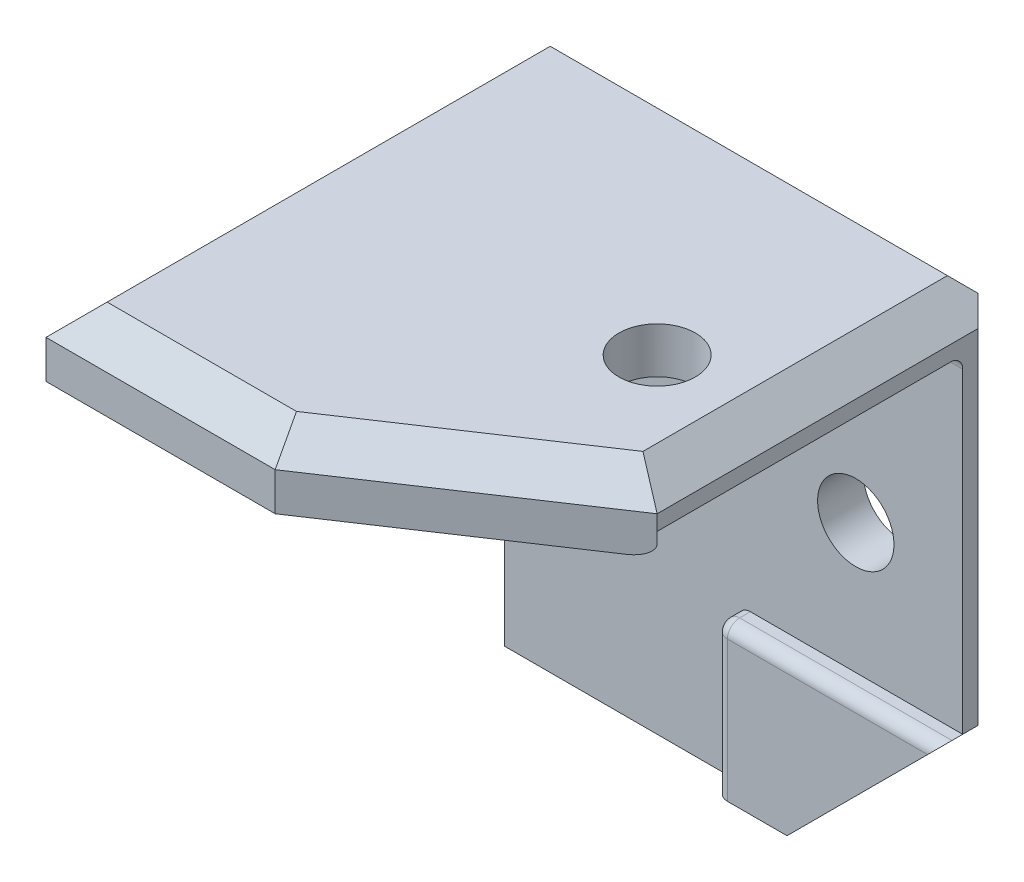
from build123d import *

# Parameters (mm, degrees)
BOSS_EXTRUDE1_DEPTH = 3
SKETCH2_W           = 15
SKETCH2_H           = 6.5
BOSS_EXTRUDE2_DEPTH = 1.5
BOSS_EXTRUDE3_DEPTH = 4.5
CUT_EXTRUDE1_DEPTH  = 1.5
FILLET1_R           = 0.8
CHAMFER1_SIZE       = 2
CHAMFER2_SIZE       = 2
FILLET2_R           = 0.8
SKETCH5_R           = 2.5
CUT_EXTRUDE2_DEPTH  = 57.384838388
SKETCH6_R           = 2.5
CUT_EXTRUDE3_DEPTH  = 57.384838388


with BuildPart() as part:
    # Sketch1 → Boss-Extrude1 (new body)
    with BuildSketch(Plane.XY):
        Polygon((0, 0), (20, 0), (30, 10), (30, 30), (0, 30), align=None)
    extrude(amount=BOSS_EXTRUDE1_DEPTH)

    # Sketch2 → Boss-Extrude2 (add)
    with BuildSketch(Plane.XY.offset(3)):
        Polygon((30, 10), (15.3, 10), (15.3, 0), (20, 0), align=None)
        with Locations((7.5, 26.75)):
            Rectangle(SKETCH2_W, SKETCH2_H)
    extrude(amount=BOSS_EXTRUDE2_DEPTH)

    # Sketch3 → Boss-Extrude3 (add)
    with BuildSketch(Plane(origin=(0, 30, 0), x_dir=(1, 0, 0), z_dir=(0, 1, 0))):
        Polygon((0, -3), (0, -33), (15, -33), (30, -23), (30, -3), (30, 0), (0, 0), align=None)
    extrude(amount=BOSS_EXTRUDE3_DEPTH)

    # Sketch4 → Cut-Extrude1 (cut)
    with BuildSketch(Plane.XZ.offset(-30)):
        Polygon((15, 23), (30, 23), (30, 3), (15, 3), (15, 4.5), align=None)
    extrude(amount=-CUT_EXTRUDE1_DEPTH, mode=Mode.SUBTRACT)

    # Fillet1
    fillet1_edges = [part.edges().sort_by_distance(p)[0] for p in [
        (15, 23.5, 3.75),
        (7.5, 23.5, 4.5),
        (15, 26.75, 4.5),
        (15.3, 5, 4.5),
        (15.3, 10, 3.75),
        (22.65, 10, 4.5),
        (15, 30, 13.75),
        (22.5, 30, 23),
        (15, 30.75, 23),
    ]]
    fillet(fillet1_edges, radius=FILLET1_R)

    # Chamfer1
    chamfer1_edges = [part.edges().sort_by_distance(p)[0] for p in [
        (15, 34.5, 0),
    ]]
    chamfer(chamfer1_edges, length=CHAMFER1_SIZE)

    # Chamfer2
    # the kernel refuses this chamfer: 2 mm, written as the material it takes off along each edge
    with BuildSketch(Plane(origin=(30, 37.643365976, 0), x_dir=(-0.9996219169112968, 0, -0.02749587661058639), z_dir=(0, -1, 0))) as chamfer2_piece_1:
        Polygon((CHAMFER2_SIZE * 0.999621916911, -CHAMFER2_SIZE * 0.0274958766106), (-CHAMFER2_SIZE * 0.0274958766106, -CHAMFER2_SIZE * 0.999621916911), (0, 0), align=None)
    extrude(amount=32.786731952, mode=Mode.SUBTRACT)
    with BuildSketch(Plane(origin=(16.36309104, -3.63690896, 0), x_dir=(-0.7068394360706732, 0.7068394360706737, -0.027495876610586376), z_dir=(0.7071067811865478, 0.7071067811865474, 0))) as chamfer2_piece_2:
        Polygon((CHAMFER2_SIZE * 0.999621916911, CHAMFER2_SIZE * 0.0274958766106), (-CHAMFER2_SIZE * 0.0274958766106, CHAMFER2_SIZE * 0.999621916911), (0, 0), align=None)
    extrude(amount=24.428867576, mode=Mode.SUBTRACT)
    with BuildSketch(Plane(origin=(-5.143365976, 0, 0), x_dir=(0, 0.9996219169112968, -0.027495876610586372), z_dir=(1, 0, 0))) as chamfer2_piece_3:
        Polygon((CHAMFER2_SIZE * 0.999621916911, CHAMFER2_SIZE * 0.0274958766106), (-CHAMFER2_SIZE * 0.0274958766106, CHAMFER2_SIZE * 0.999621916911), (0, 0), align=None)
    extrude(amount=30.286731952, mode=Mode.SUBTRACT)
    with BuildSketch(Plane(origin=(0, 37.643365976, 0), x_dir=(-0.027495876610586372, 0, 0.9996219169112968), z_dir=(0, -1, 0))) as chamfer2_piece_4:
        Polygon((CHAMFER2_SIZE * 0.999621916911, -CHAMFER2_SIZE * 0.0274958766106), (-CHAMFER2_SIZE * 0.0274958766106, -CHAMFER2_SIZE * 0.999621916911), (0, 0), align=None)
    extrude(amount=42.786731952, mode=Mode.SUBTRACT)
    with BuildSketch(Plane(origin=(0, 34.5, 38.143365976), x_dir=(-0.0274958766105864, -0.9996219169112968, 0), z_dir=(0, 0, -1))) as chamfer2_piece_5:
        Polygon((CHAMFER2_SIZE * 0.999621916911, -CHAMFER2_SIZE * 0.0274958766106), (-CHAMFER2_SIZE * 0.0274958766106, -CHAMFER2_SIZE * 0.999621916911), (0, 0), align=None)
    extrude(amount=41.286731952, mode=Mode.SUBTRACT)
    with BuildSketch(Plane(origin=(30, 34.5, -3.143365976), x_dir=(-0.9996219169112968, 0.027495876610585647, 0), z_dir=(0, 0, 1))) as chamfer2_piece_6:
        Polygon((CHAMFER2_SIZE * 0.999621916911, CHAMFER2_SIZE * 0.0274958766106), (-CHAMFER2_SIZE * 0.0274958766106, CHAMFER2_SIZE * 0.999621916911), (0, 0), align=None)
    extrude(amount=31.286731952, mode=Mode.SUBTRACT)
    with BuildSketch(Plane(origin=(10.720460826, 34.5, 35.853026116), x_dir=(-0.5544904734617357, 0.027495876610585605, -0.8317357101926042), z_dir=(0.8320502943378439, 0, -0.5547001962252288))) as chamfer2_piece_7:
        Polygon((CHAMFER2_SIZE * 0.999621916911, -CHAMFER2_SIZE * 0.0274958766106), (-CHAMFER2_SIZE * 0.0274958766106, -CHAMFER2_SIZE * 0.999621916911), (0, 0), align=None)
    extrude(amount=28.314488329, mode=Mode.SUBTRACT)
    with BuildSketch(Plane(origin=(-5.143365976, 34.5, 33), x_dir=(0, 0.027495876610585647, -0.9996219169112968), z_dir=(1, 0, 0))) as chamfer2_piece_8:
        Polygon((CHAMFER2_SIZE * 0.999621916911, -CHAMFER2_SIZE * 0.0274958766106), (-CHAMFER2_SIZE * 0.0274958766106, -CHAMFER2_SIZE * 0.999621916911), (0, 0), align=None)
    extrude(amount=25.286731952, mode=Mode.SUBTRACT)

    # Fillet2
    fillet2_edges = [part.edges().sort_by_distance(p)[0] for p in [
        (22.5, 31.5, 3),
    ]]
    fillet(fillet2_edges, radius=FILLET2_R)

    # Sketch5 → Cut-Extrude2 (cut, through all)
    with BuildSketch(Plane(origin=(0, 0, 0), x_dir=(-1, 0, 0), z_dir=(0, 0, -1))):
        with Locations((-23, 18.5)):
            Circle(SKETCH5_R)
    extrude(amount=-CUT_EXTRUDE2_DEPTH, mode=Mode.SUBTRACT)

    # Sketch6 → Cut-Extrude3 (cut, through all)
    with BuildSketch(Plane(origin=(0, 34.5, 0), x_dir=(1, 0, 0), z_dir=(0, 1, 0))):
        with Locations(Location((23, -16, 0), (0, 0, 180))):
            Circle(SKETCH6_R)
    extrude(amount=-CUT_EXTRUDE3_DEPTH, mode=Mode.SUBTRACT)


solid = part.part
